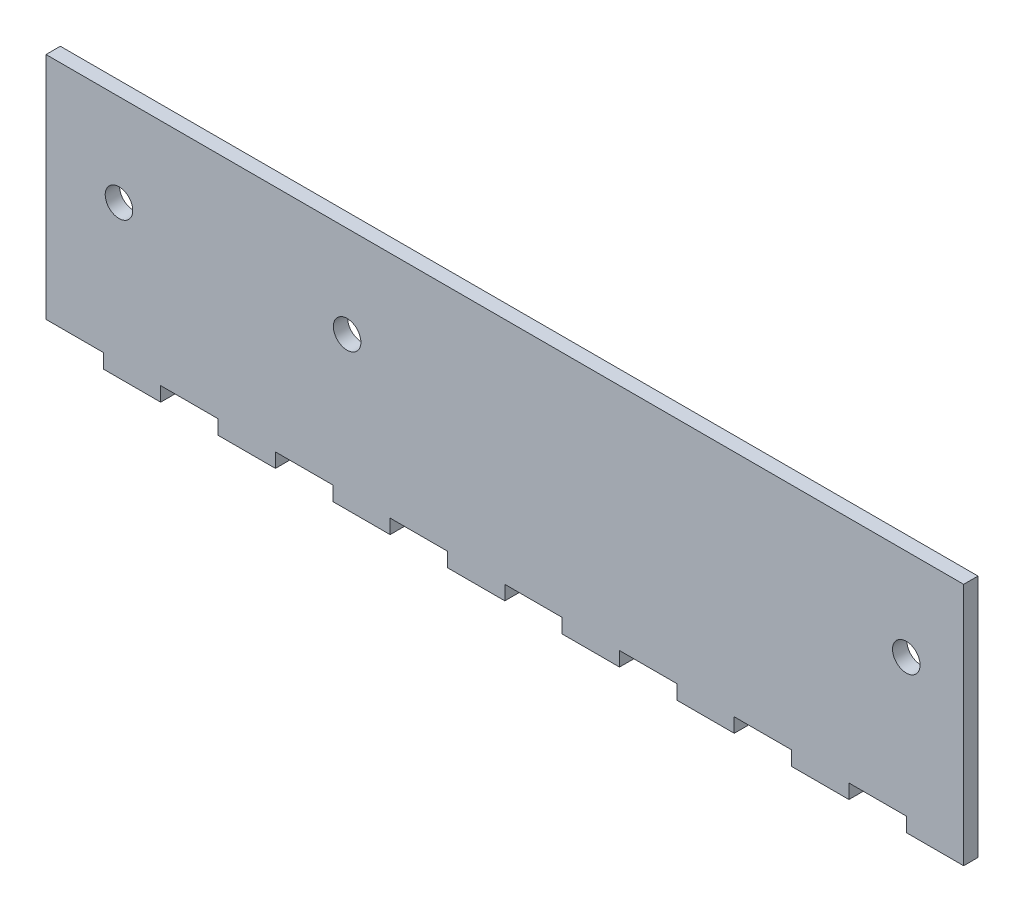
from build123d import *

# Parameters (mm, degrees)
SKETCH1_W           = 203.2
SKETCH1_H           = 50.8
SKETCH1_R           = 3.048
BOSS_EXTRUDE1_DEPTH = 3.175
SKETCH2_W           = 12.7
SKETCH2_H           = 3.175
BOSS_EXTRUDE2_DEPTH = 3.175


with BuildPart() as part:
    # Sketch1 → Boss-Extrude1 (new body)
    with BuildSketch(Plane.XY):
        with Locations((101.6, 25.4)):
            Rectangle(SKETCH1_W, SKETCH1_H)
        with Locations((190.5, 30.48)):
            Circle(SKETCH1_R, mode=Mode.SUBTRACT)
        with Locations((66.675, 30.48)):
            Circle(SKETCH1_R, mode=Mode.SUBTRACT)
        with Locations((16.16075, 30.48)):
            Circle(SKETCH1_R, mode=Mode.SUBTRACT)
    extrude(amount=BOSS_EXTRUDE1_DEPTH)

    # Sketch2 → Boss-Extrude2 (add)
    with BuildSketch(Plane.XZ):
        with Locations((196.85, 1.5875)):
            Rectangle(SKETCH2_W, SKETCH2_H)
        with Locations((171.45, 1.5875)):
            Rectangle(SKETCH2_W, SKETCH2_H)
        with Locations((146.05, 1.5875)):
            Rectangle(SKETCH2_W, SKETCH2_H)
        with Locations((120.65, 1.5875)):
            Rectangle(SKETCH2_W, SKETCH2_H)
        with Locations((95.25, 1.5875)):
            Rectangle(SKETCH2_W, SKETCH2_H)
        with Locations((69.85, 1.5875)):
            Rectangle(SKETCH2_W, SKETCH2_H)
        with Locations((44.45, 1.5875)):
            Rectangle(SKETCH2_W, SKETCH2_H)
        with Locations((19.05, 1.5875)):
            Rectangle(SKETCH2_W, SKETCH2_H)
    extrude(amount=BOSS_EXTRUDE2_DEPTH)


solid = part.part
